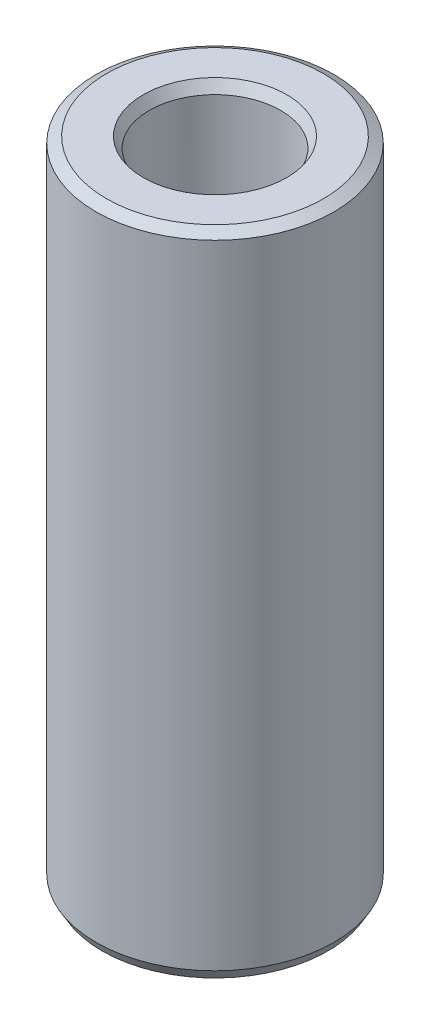
from build123d import *
from OCP.BRepFilletAPI import BRepFilletAPI_MakeChamfer

# Parameters (mm, degrees)
SKETCH1_R           = 42.5
BOSS_EXTRUDE1_DEPTH = 231.875070661
SKETCH2_R           = 23.479993077
CUT_EXTRUDE1_DEPTH  = 240.538198194
CHAMFER1_SIZE       = 2.170574045
CHAMFER1_SIZE2      = 3.759544527


with BuildPart() as part:
    # Sketch1 → Boss-Extrude1 (new body)
    with BuildSketch(Plane(origin=(0, 0, 0), x_dir=(1, 0, 0), z_dir=(0, 1, 0))):
        Circle(SKETCH1_R)
    extrude(amount=BOSS_EXTRUDE1_DEPTH)

    # Sketch2 → Cut-Extrude1 (cut, through all)
    with BuildSketch(Plane(origin=(0, 0, 0), x_dir=(1, 0, 0), z_dir=(0, 1, 0))):
        Circle(SKETCH2_R)
    extrude(amount=CUT_EXTRUDE1_DEPTH, mode=Mode.SUBTRACT)

    # Chamfer1: one chamfer whose edges measure the first distance from different faces: ONE call of the kernel's chamfer builder (chamfer() names one face for all edges)
    chamfer1_edges_1 = [part.edges().sort_by_distance(p)[0] for p in [
        (-23.479993077, 231.875070661, 0),
    ]]
    chamfer1_side_1 = [part.faces().sort_by_distance(p)[0] for p in [
        (-41.297918472, 231.875070661, 0),
    ]]
    chamfer1_edges_2 = [part.edges().sort_by_distance(p)[0] for p in [
        (-23.479993077, 0, 0),
    ]]
    chamfer1_side_2 = [part.faces().sort_by_distance(p)[0] for p in [
        (-23.479993077, 115.93753533, 0),
    ]]
    chamfer1_edges_3 = [part.edges().sort_by_distance(p)[0] for p in [
        (-42.5, 0, 0),
    ]]
    chamfer1_side_3 = [part.faces().sort_by_distance(p)[0] for p in [
        (-41.297918472, 0, 0),
    ]]
    chamfer1_edges_4 = [part.edges().sort_by_distance(p)[0] for p in [
        (-42.5, 231.875070661, 0),
    ]]
    chamfer1_side_4 = [part.faces().sort_by_distance(p)[0] for p in [
        (-42.5, 115.93753533, 0),
    ]]
    chamfer1 = BRepFilletAPI_MakeChamfer(part.part.solid().wrapped)
    for e in chamfer1_edges_1:
        chamfer1.Add(CHAMFER1_SIZE, CHAMFER1_SIZE2, e.wrapped, chamfer1_side_1[0].wrapped)  # the first distance lies on this face
    for e in chamfer1_edges_2:
        chamfer1.Add(CHAMFER1_SIZE, CHAMFER1_SIZE2, e.wrapped, chamfer1_side_2[0].wrapped)  # the first distance lies on this face
    for e in chamfer1_edges_3:
        chamfer1.Add(CHAMFER1_SIZE, CHAMFER1_SIZE2, e.wrapped, chamfer1_side_3[0].wrapped)  # the first distance lies on this face
    for e in chamfer1_edges_4:
        chamfer1.Add(CHAMFER1_SIZE, CHAMFER1_SIZE2, e.wrapped, chamfer1_side_4[0].wrapped)  # the first distance lies on this face
    add(Compound.cast(chamfer1.Shape()), mode=Mode.REPLACE)


solid = part.part
